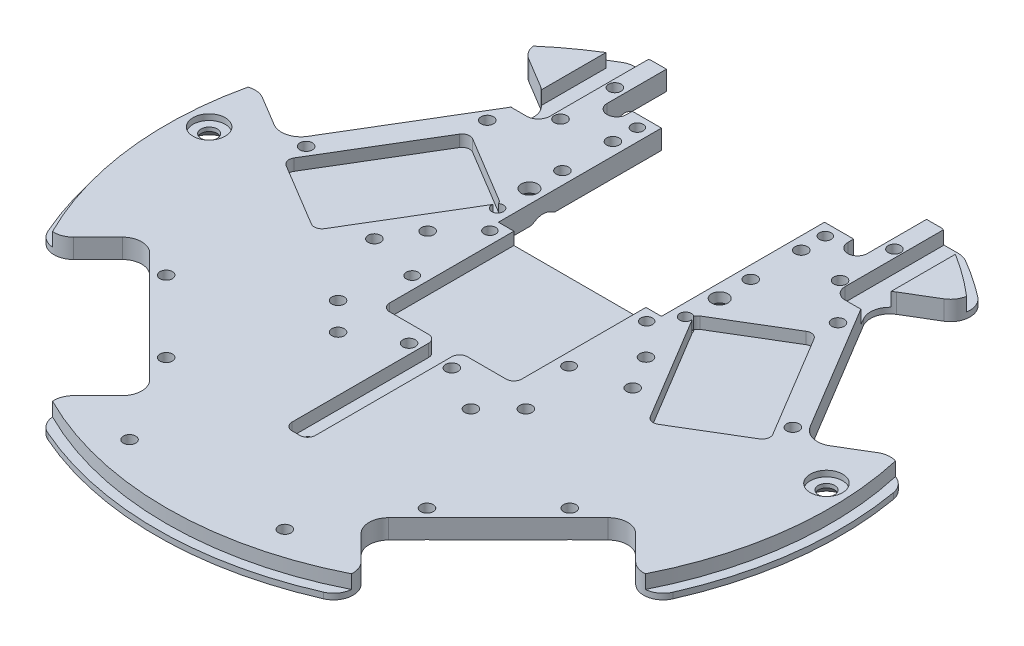
from build123d import *

# Parameters (mm, degrees)
EXTRUDE1_DEPTH      = 5
SKETCH3_W           = 42
SKETCH3_H           = 55.778903352
EXTRUDE2_DEPTH      = 5
EXTRUDE3_DEPTH      = 3.2
EXTRUDE4_DEPTH      = 3
SKETCH6_R           = 1.6
EXTRUDE5_DEPTH      = 5
EXTRUDE6_REACH      = 126.551
SKETCH7_R           = 1.5
EXTRUDE7_DEPTH      = 5
SKETCH9_R           = 1.6
EXTRUDE8_DEPTH      = 5
FILLET2_R           = 2
FILLET3_R           = 5
FILLET4_R           = 5
SKETCH11_R          = 2.1
EXTRUDE10_DEPTH     = 5
SKETCH27_R          = 1.5
SKETCH27_R_2        = 1.531095219
EXTRUDE26_DEPTH     = 5
SKETCH29_R          = 4.15
EXTRUDE28_DEPTH     = 1.5
SKETCH30_R          = 2.1
EXTRUDE29_DEPTH     = 3.5
SKETCH14_R          = 1.6
EXTRUDE30_DEPTH     = 5
CUT_EXTRUDE1_DEPTH  = 3.5
SKETCH33_W          = 7
SKETCH33_H          = 28.5
CUT_EXTRUDE3_DEPTH  = 3.5
FILLET5_R           = 3
SKETCH34_W          = 5
SKETCH34_H          = 4
CUT_EXTRUDE4_DEPTH  = 10
FILLET6_R           = 2.5
SKETCH37_R          = 1.6
CUT_EXTRUDE7_DEPTH  = 10
SKETCH38_R          = 1.25
CUT_EXTRUDE8_DEPTH  = 10
SKETCH39_R          = 1.6
CUT_EXTRUDE9_DEPTH  = 10
SKETCH44_R          = 1.6
CUT_EXTRUDE10_DEPTH = 60
CHAMFER1_SIZE       = 1.5
CHAMFER2_SIZE       = 2.5


# Some blends are built 0.0001 mm under size
with BuildPart() as part:
    # Sketch2 → Extrude1 (new body)
    with BuildSketch(Plane(origin=(0, 0, 0), x_dir=(1, 0, 0), z_dir=(0, 1, 0))):
        with BuildLine():
            Line((85.19872856, 22.026725852), (67.306075467, 11.275735239))
            Line((67.306075467, 11.275735239), (41.554171722, 54.134100274))
            Line((41.554171722, 54.134100274), (59.446824814, 64.885090888))
            ThreePointArc((59.446824814, 64.885090888), (51.56746719, 71.307757836), (43, 76.778903352))
            Line((43, 76.778903352), (-43, 76.778903352))
            ThreePointArc((-43, 76.778903352), (-51.56746719, 71.307757836), (-59.446824814, 64.885090888))
            Line((-59.446824814, 64.885090888), (-41.554171722, 54.134100274))
            Line((-41.554171722, 54.134100274), (-67.306075467, 11.275735239))
            Line((-67.306075467, 11.275735239), (-85.19872856, 22.026725852))
            ThreePointArc((-85.19872856, 22.026725852), (-87.344061344, -10.72450222), (-77.339214934, -41.983875874))
            Line((-77.339214934, -41.983875874), (-62.578950135, -27.223611076))
            Line((-62.578950135, -27.223611076), (-27.223611076, -62.578950135))
            Line((-27.223611076, -62.578950135), (-41.983875874, -77.339214934))
            ThreePointArc((-41.983875874, -77.339214934), (0, -88), (41.983875874, -77.339214934))
            Line((41.983875874, -77.339214934), (27.223611076, -62.578950135))
            Line((27.223611076, -62.578950135), (62.578950135, -27.223611076))
            Line((62.578950135, -27.223611076), (77.339214934, -41.983875874))
            ThreePointArc((77.339214934, -41.983875874), (87.344061344, -10.72450222), (85.19872856, 22.026725852))
        make_face()
    extrude(amount=-EXTRUDE1_DEPTH)

    # Sketch3 → Extrude2 (cut)
    with BuildSketch(Plane(origin=(0, 0, 0), x_dir=(1, 0, 0), z_dir=(0, 1, 0))):
        with Locations((0, 48.889451676)):
            Rectangle(SKETCH3_W, SKETCH3_H)
    extrude(amount=-EXTRUDE2_DEPTH, mode=Mode.SUBTRACT)

    # Sketch4 → Extrude3 (cut)
    with BuildSketch(Plane(origin=(0, 0, 0), x_dir=(-1, 0, 0), z_dir=(0, 1, 0))):
        Polygon((17, 13), (17, -27), (-17, -27), (-17, 13), (-3, 13), (-3, 52.119044648), (3, 52.119044648), (3, 13), align=None)
    extrude(amount=-EXTRUDE3_DEPTH, mode=Mode.SUBTRACT)

    # Sketch5 → Extrude4 (cut)
    with BuildSketch(Plane(origin=(0, 0, 0), x_dir=(1, 0, 0), z_dir=(0, 1, 0))):
        Polygon((42.963261822, -4.517536234), (62.678109738, 7.328339489), (44.651777116, 37.329195014), (24.9369292, 25.483319291), align=None)
    extrude4 = extrude(amount=-EXTRUDE4_DEPTH, mode=Mode.SUBTRACT)

    # Mirror1: Extrude4 across plane
    add(extrude4.mirror(Plane(origin=(0, 0, 0), x_dir=(0, 0, 1), z_dir=(1, 0, 0))), mode=Mode.SUBTRACT)

    # Sketch6 → Extrude5 (cut)
    with BuildSketch(Plane(origin=(0, 0, 0), x_dir=(1, 0, 0), z_dir=(0, 1, 0))):
        with Locations(Location((45.163126719, 42.302978441, 0), (0, 0, 270))):
            Circle(SKETCH6_R)
        with Locations(Location((62.674421266, 13.159290217, 0), (0, 0, 270))):
            Circle(SKETCH6_R)
        with Locations(Location((51.972348417, -33.587572106, 0), (0, 0, 270))):
            Circle(SKETCH6_R)
        with Locations(Location((33.587572106, -51.972348417, 0), (0, 0, 270))):
            Circle(SKETCH6_R)
    extrude5 = extrude(amount=-EXTRUDE5_DEPTH, mode=Mode.SUBTRACT)

    # Mirror2: Extrude5 across plane
    add(extrude5.mirror(Plane(origin=(0, 0, 0), x_dir=(0, 0, 1), z_dir=(1, 0, 0))), mode=Mode.SUBTRACT)

    # Extrude6: up to this face of the body (flat: up to its plane)
    extrude6_end = Plane(part.part.faces().sort_by_distance((0, -5, 8.032320255))[0])
    # Sketch7 → Extrude6 (cut, up to the picked face)
    with BuildSketch(Plane(origin=(0, 0, 0), x_dir=(-1, 0, 0), z_dir=(0, 1, 0)), mode=Mode.PRIVATE) as extrude6_sk1:
        with Locations(Location((-24.2, -60, 0), (0, 0, 90))):
            Circle(SKETCH7_R)
    extrude6_tool1 = split(extrude(extrude6_sk1.sketch, amount=-EXTRUDE6_REACH, mode=Mode.PRIVATE), bisect_by=extrude6_end, keep=Keep.BOTH, mode=Mode.PRIVATE)
    # Sketch7 → Extrude6 (cut, up to the picked face)
    with BuildSketch(Plane(origin=(0, 0, 0), x_dir=(-1, 0, 0), z_dir=(0, 1, 0)), mode=Mode.PRIVATE) as extrude6_sk2:
        with Locations(Location((-24.2, -24, 0), (0, 0, 189.501164513))):
            Circle(SKETCH7_R)
    extrude6_tool2 = split(extrude(extrude6_sk2.sketch, amount=-EXTRUDE6_REACH, mode=Mode.PRIVATE), bisect_by=extrude6_end, keep=Keep.BOTH, mode=Mode.PRIVATE)
    extrude6_1 = extrude6_tool1.solids().sort_by(Axis((24.2, 0, -60), (0, -1, 0)))[0]
    add(extrude6_1, mode=Mode.SUBTRACT)
    extrude6_2 = extrude6_tool2.solids().sort_by(Axis((24.2, 0, -24), (0, -1, 0)))[0]
    add(extrude6_2, mode=Mode.SUBTRACT)
    extrude6 = extrude6_1 + extrude6_2  # Extrude6 as one shape, for the pattern or mirror that repeats it

    # Mirror3: Extrude6 across plane
    add(extrude6.mirror(Plane(origin=(0, 0, 0), x_dir=(0, 0, 1), z_dir=(1, 0, 0))), mode=Mode.SUBTRACT)

    # Sketch8 → Extrude7 (cut)
    with BuildSketch(Plane(origin=(0, 0, 0), x_dir=(1, 0, 0), z_dir=(0, 1, 0))):
        Polygon((33.5, 68.73438437), (33.5, 63), (21, 63), (21, 76.778903352), (33.5, 76.778903352), align=None)
    extrude7 = extrude(amount=-EXTRUDE7_DEPTH, mode=Mode.SUBTRACT)

    # Mirror4: Extrude7 across plane
    add(extrude7.mirror(Plane(origin=(0, 0, 0), x_dir=(0, 0, 1), z_dir=(1, 0, 0))), mode=Mode.SUBTRACT)

    # Sketch9 → Extrude8 (cut)
    with BuildSketch(Plane(origin=(0, 0, 0), x_dir=(1, 0, 0), z_dir=(0, 1, 0))):
        with Locations(Location((36, 66, 0), (0, 0, 270))):
            Circle(SKETCH9_R)
        with Locations(Location((36, 52, 0), (0, 0, 270))):
            Circle(SKETCH9_R)
    extrude8 = extrude(amount=-EXTRUDE8_DEPTH, mode=Mode.SUBTRACT)

    # Mirror5: Extrude8 across plane
    add(extrude8.mirror(Plane(origin=(0, 0, 0), x_dir=(0, 0, 1), z_dir=(1, 0, 0))), mode=Mode.SUBTRACT)

    # Fillet2
    # the kernel refuses this fillet: 2 mm, written as the material it adds along each edge
    with BuildSketch(Plane(origin=(42.963261822, 0, 4.517536234), x_dir=(0.8571673007021109, 0, -0.5150380749100568), z_dir=(0, -1, 0)), Plane(origin=(-42.963261822, 0, 4.517536234), x_dir=(0.5150380749100563, 0, -0.857167300702111), z_dir=(0, -1, 0)), Plane(origin=(-62.678109738, 0, -7.328339489), x_dir=(0.85716730070211, 0, 0.5150380749100579), z_dir=(0, -1, 0))) as fillet2_piece_1:
        with BuildLine():
            CenterArc((FILLET2_R, -FILLET2_R), FILLET2_R, 90, 90)
            Line((0, -FILLET2_R), (0, 0))
            Line((0, 0), (FILLET2_R, 0))
        make_face()
    extrude(amount=3)
    with BuildSketch(Plane(origin=(24.9369292, 0, -25.483319291), x_dir=(0.8571673007021124, 0, -0.5150380749100538), z_dir=(0, -1, 0))) as fillet2_piece_2:
        with BuildLine():
            CenterArc((1.118768015, 2), FILLET2_R, 235.986791547, 34.013208453)
            Line((0, 0.342182722), (0, 0))
            Line((0, 0), (1.118768015, 0))
        make_face()
    extrude(amount=3)
    with BuildSketch(Plane(origin=(44.651777116, 0, -37.329195014), x_dir=(0.5150380749100567, 0, 0.8571673007021108), z_dir=(0, -1, 0)), Plane(origin=(62.678109738, 0, -7.328339489), x_dir=(-0.85716730070211, 0, 0.5150380749100579), z_dir=(0, -1, 0)), Plane(origin=(-44.651777116, 0, -37.329195014), x_dir=(0.8571673007021102, 0, 0.5150380749100578), z_dir=(0, -1, 0))) as fillet2_piece_3:
        with BuildLine():
            CenterArc((FILLET2_R, FILLET2_R), FILLET2_R, 180, 90)
            Line((0, FILLET2_R), (0, 0))
            Line((0, 0), (FILLET2_R, 0))
        make_face()
    extrude(amount=3)
    with BuildSketch(Plane(origin=(-24.9369292, 0, -25.483319291), x_dir=(-0.5150380749118738, 0, 0.857167300701019), z_dir=(0, -1, 0))) as fillet2_piece_4:
        with BuildLine():
            CenterArc((2, 1.118768015), FILLET2_R, 180, 34.013208453)
            Line((0, 1.118768015), (0, 0))
            Line((0, 0), (0.342182722, 0))
        make_face()
    extrude(amount=3)
    with BuildSketch(Plane(origin=(-17, 0, 13), x_dir=(0, 0, -1), z_dir=(0, -1, 0))) as fillet2_piece_5:
        with BuildLine():
            CenterArc((FILLET2_R, FILLET2_R), FILLET2_R, 180, 90)
            Line((0, FILLET2_R), (0, 0))
            Line((0, 0), (FILLET2_R, 0))
        make_face()
    extrude(amount=3.2)
    with BuildSketch(Plane(origin=(17, 0, 13), x_dir=(0, 0, -1), z_dir=(0, -1, 0)), Plane(origin=(3, 0, 52.119044648), x_dir=(0, 0, -1), z_dir=(0, -1, 0)), Plane(origin=(-3, 0, 52.119044648), x_dir=(1, 0, 0), z_dir=(0, -1, 0))) as fillet2_piece_6:
        with BuildLine():
            CenterArc((FILLET2_R, -FILLET2_R), FILLET2_R, 90, 90)
            Line((0, -FILLET2_R), (0, 0))
            Line((0, 0), (FILLET2_R, 0))
        make_face()
    extrude(amount=3.2)
    # the kernel refuses this fillet: 2 mm, written as the material it takes off along each edge
    with BuildSketch(Plane(origin=(3, 5, 13), x_dir=(1, 0, 0), z_dir=(0, -1, 0))) as fillet2_2_piece_1:
        with BuildLine():
            CenterArc((FILLET2_R, FILLET2_R), FILLET2_R, 180, 90)
            Line((0, FILLET2_R), (0, 0))
            Line((0, 0), (FILLET2_R, 0))
        make_face()
    extrude(amount=8.2, mode=Mode.SUBTRACT)
    with BuildSketch(Plane(origin=(-3, 5, 13), x_dir=(-1, 0, 0), z_dir=(0, -1, 0))) as fillet2_2_piece_2:
        with BuildLine():
            CenterArc((FILLET2_R, -FILLET2_R), FILLET2_R, 90, 90)
            Line((0, -FILLET2_R), (0, 0))
            Line((0, 0), (FILLET2_R, 0))
        make_face()
    extrude(amount=8.2, mode=Mode.SUBTRACT)

    # Fillet3
    fillet3_edges = [part.edges().sort_by_distance(p)[0] for p in [
        (77.339214934, -2.5, 41.983875874),
        (62.578950135, -2.5, 27.223611076),
        (27.223611076, -2.5, 62.578950135),
        (41.983875874, -2.5, 77.339214934),
        (-41.983875874, -2.5, 77.339214934),
        (-27.223611076, -2.5, 62.578950135),
        (-62.578950135, -2.5, 27.223611076),
        (-77.339214934, -2.5, 41.983875874),
        (-85.19872856, -2.5, -22.026725852),
        (-67.306075467, -2.5, -11.275735239),
        (-41.554171722, -2.5, -54.134100274),
        (-59.446824814, -2.5, -64.885090888),
        (59.446824814, -2.5, -64.885090888),
        (41.554171722, -2.5, -54.134100274),
        (67.306075467, -2.5, -11.275735239),
        (85.19872856, -2.5, -22.026725852),
    ]]
    fillet(fillet3_edges, radius=FILLET3_R)

    # Fillet4
    fillet4_edges = [part.edges().sort_by_distance(p)[0] for p in [
        (-43, -2.5, -76.778903352),
        (43, -2.5, -76.778903352),
    ]]
    fillet(fillet4_edges, radius=FILLET4_R)

    # Sketch11 → Extrude10 (cut)
    with BuildSketch(Plane(origin=(0, 0, 0), x_dir=(1, 0, 0), z_dir=(0, 1, 0))):
        with Locations(Location((24.5, 32.5, 0), (0, 0, 270))):
            Circle(SKETCH11_R)
        with Locations(Location((-24.5, 32.5, 0), (0, 0, 270))):
            Circle(SKETCH11_R)
    extrude(amount=-EXTRUDE10_DEPTH, mode=Mode.SUBTRACT)

    # Sketch27 → Extrude26 (cut)
    with BuildSketch(Plane(origin=(0, 0, 0), x_dir=(1, 0, 0), z_dir=(0, 1, 0))):
        with Locations(Location((20.2, 18, 0), (0, 0, 270))):
            Circle(SKETCH27_R)
        with Locations(Location((-20.2, 18, 0), (0, 0, 270))):
            Circle(SKETCH27_R)
        with Locations(Location((-20.2, -2, 0), (0, 0, 270))):
            Circle(SKETCH27_R_2)
        with Locations(Location((20.2, -2, 0), (0, 0, 90))):
            Circle(SKETCH27_R_2)
    extrude(amount=-EXTRUDE26_DEPTH, mode=Mode.SUBTRACT)

    # Sketch29 → Extrude28 (cut)
    with BuildSketch(Plane(origin=(0, 0, 0), x_dir=(1, 0, 0), z_dir=(0, 1, 0))):
        with Locations(Location((-79.5, 5, 0), (0, 0, 270))):
            Circle(SKETCH29_R)
        with Locations(Location((79.5, 5, 0), (0, 0, 270))):
            Circle(SKETCH29_R)
    extrude(amount=-EXTRUDE28_DEPTH, mode=Mode.SUBTRACT)

    # Sketch30 → Extrude29 (cut)
    with BuildSketch(Plane(origin=(0, -1.5, 0), x_dir=(1, 0, 0), z_dir=(0, 1, 0))):
        with Locations(Location((79.5, 5, 0), (0, 0, 270))):
            Circle(SKETCH30_R)
        with Locations(Location((-79.5, 5, 0), (0, 0, 270))):
            Circle(SKETCH30_R)
    extrude(amount=-EXTRUDE29_DEPTH, mode=Mode.SUBTRACT)

    # Sketch14 → Extrude30 (cut)
    with BuildSketch(Plane(origin=(0, 0, 0), x_dir=(1, 0, 0), z_dir=(0, 1, 0))):
        with Locations(Location((24.183051917, -17.111984105, 0), (0, 0, 270))):
            Circle(SKETCH14_R)
        with Locations(Location((17.111984105, -24.183051917, 0), (0, 0, 270))):
            Circle(SKETCH14_R)
        with Locations(Location((28.11951363, 9.896107983, 0), (0, 0, 270))):
            Circle(SKETCH14_R)
        with Locations(Location((33.269894379, 1.324434976, 0), (0, 0, 270))):
            Circle(SKETCH14_R)
    extrude30 = extrude(amount=-EXTRUDE30_DEPTH, mode=Mode.SUBTRACT)

    # Mirror9: Extrude30 across plane
    add(extrude30.mirror(Plane(origin=(0, 0, 0), x_dir=(0, 0, 1), z_dir=(1, 0, 0))), mode=Mode.SUBTRACT)

    # Sketch31 → Cut-Extrude1 (cut)
    with BuildSketch(Plane(origin=(0, 0, 0), x_dir=(1, 0, 0), z_dir=(0, 1, 0))):
        with BuildLine():
            Line((-29.58455324, 80.218477981), (-30.449598656, 82.564047513))
            ThreePointArc((-30.449598656, 82.564047513), (1.248527649, -87.991142615), (28.094769088, 83.394747736))
            Line((28.094769088, 83.394747736), (28.261361905, 80.694147392))
            ThreePointArc((28.261361905, 80.694147392), (0.703046353, -85.497109459), (-29.58455324, 80.218477981))
        make_face()
    extrude(amount=-CUT_EXTRUDE1_DEPTH, mode=Mode.SUBTRACT)

    # Sketch33 → Cut-Extrude3 (cut)
    with BuildSketch(Plane(origin=(0, 0, 0), x_dir=(1, 0, 0), z_dir=(0, 1, 0))):
        with Locations((-41.5, 62.528903352)):
            Rectangle(SKETCH33_W, SKETCH33_H)
        with Locations((41.5, 62.528903352)):
            Rectangle(SKETCH33_W, SKETCH33_H)
    extrude(amount=-CUT_EXTRUDE3_DEPTH, mode=Mode.SUBTRACT)

    # Fillet5
    fillet5_edges = [part.edges().sort_by_distance(p)[0] for p in [
        (-38, -1.75, -48.278903352),
        (38, -1.75, -48.278903352),
    ]]
    fillet(fillet5_edges, radius=FILLET5_R)

    # Sketch34 → Cut-Extrude4 (cut)
    with BuildSketch(Plane(origin=(0, 0, 0), x_dir=(1, 0, 0), z_dir=(0, 1, 0))):
        with Locations((-31, 61)):
            Rectangle(SKETCH34_W, SKETCH34_H)
        with Locations((31, 61)):
            Rectangle(SKETCH34_W, SKETCH34_H)
    extrude(amount=-CUT_EXTRUDE4_DEPTH, mode=Mode.SUBTRACT)

    # Fillet6
    fillet6_edges = [part.edges().sort_by_distance(p)[0] for p in [
        (28.5, -2.5, -59),
        (33.5, -2.5, -59),
        (-28.5, -2.5, -59),
        (-33.5, -2.5, -59),
    ]]
    fillet(fillet6_edges, radius=FILLET6_R - 0.0001)  # a hair under: the kernel refuses the full size

    # Sketch37 → Cut-Extrude7 (cut)
    with BuildSketch(Plane(origin=(0, 0, 0), x_dir=(1, 0, 0), z_dir=(0, 1, 0))):
        with Locations(Location((-5.5, -17.5, 0), (0, 0, 270))):
            Circle(SKETCH37_R)
        with Locations(Location((5.5, -17.5, 0), (0, 0, 270))):
            Circle(SKETCH37_R)
    extrude(amount=-CUT_EXTRUDE7_DEPTH, mode=Mode.SUBTRACT)

    # Sketch38 → Cut-Extrude8 (cut)
    with BuildSketch(Plane(origin=(0, -3.2, 0), x_dir=(1, 0, 0), z_dir=(0, 1, 0))):
        with Locations(Location((0, -49, 0), (0, 0, 270))):
            Circle(SKETCH38_R)
    extrude(amount=-CUT_EXTRUDE8_DEPTH, mode=Mode.SUBTRACT)

    # Sketch39 → Cut-Extrude9 (cut)
    with BuildSketch(Plane(origin=(0, 0, 0), x_dir=(1, 0, 0), z_dir=(0, 1, 0))):
        with Locations(Location((-24.25, 53.75, 0), (0, 0, 270))):
            Circle(SKETCH39_R)
        with Locations(Location((-24.25, 40.75, 0), (0, 0, 270))):
            Circle(SKETCH39_R)
        with Locations(Location((24.25, 40.75, 0), (0, 0, 90))):
            Circle(SKETCH39_R)
        with Locations(Location((24.25, 53.75, 0), (0, 0, 90))):
            Circle(SKETCH39_R)
    extrude(amount=-CUT_EXTRUDE9_DEPTH, mode=Mode.SUBTRACT)

    # Sketch44 → Cut-Extrude10 (cut)
    with BuildSketch(Plane(origin=(0, 0, 0), x_dir=(1, 0, 0), z_dir=(0, 1, 0))):
        with Locations(Location((-20, -75, 0), (0, 0, 270))):
            Circle(SKETCH44_R)
        with Locations(Location((20, -75, 0), (0, 0, 90))):
            Circle(SKETCH44_R)
    extrude(amount=-CUT_EXTRUDE10_DEPTH, mode=Mode.SUBTRACT)

    # Chamfer1
    # the kernel refuses this chamfer: 1.5 mm, written as the material it takes off along each edge
    with BuildSketch(Plane(origin=(45.163126719, -5, -42.302978441), x_dir=(0, 0, 1), z_dir=(-1, 0, 0))) as chamfer1_piece_1:
        Polygon((1.6 + CHAMFER1_SIZE, 0), (1.6, CHAMFER1_SIZE), (1.6, 0), align=None)
    revolve(axis=Axis((45.163126719, -5, -42.302978441), (0, 1, 0)), mode=Mode.SUBTRACT)
    with BuildSketch(Plane(origin=(62.674421266, -5, -13.159290217), x_dir=(0, 0, 1), z_dir=(-1, 0, 0))) as chamfer1_piece_2:
        Polygon((1.6 + CHAMFER1_SIZE, 0), (1.6, CHAMFER1_SIZE), (1.6, 0), align=None)
    revolve(axis=Axis((62.674421266, -5, -13.159290217), (0, 1, 0)), mode=Mode.SUBTRACT)
    with BuildSketch(Plane(origin=(51.972348417, -5, 33.587572106), x_dir=(0, 0, 1), z_dir=(-1, 0, 0))) as chamfer1_piece_3:
        Polygon((1.6 + CHAMFER1_SIZE, 0), (1.6, CHAMFER1_SIZE), (1.6, 0), align=None)
    revolve(axis=Axis((51.972348417, -5, 33.587572106), (0, 1, 0)), mode=Mode.SUBTRACT)
    with BuildSketch(Plane(origin=(33.587572106, -5, 51.972348417), x_dir=(0, 0, 1), z_dir=(-1, 0, 0))) as chamfer1_piece_4:
        Polygon((1.6 + CHAMFER1_SIZE, 0), (1.6, CHAMFER1_SIZE), (1.6, 0), align=None)
    revolve(axis=Axis((33.587572106, -5, 51.972348417), (0, 1, 0)), mode=Mode.SUBTRACT)
    with BuildSketch(Plane(origin=(-45.163126719, -5, -42.302978441), x_dir=(0, 0, 1), z_dir=(1, 0, 0))) as chamfer1_piece_5:
        Polygon((1.6 + CHAMFER1_SIZE, 0), (1.6, -CHAMFER1_SIZE), (1.6, 0), align=None)
    revolve(axis=Axis((-45.163126719, -5, -42.302978441), (0, -1, 0)), mode=Mode.SUBTRACT)
    with BuildSketch(Plane(origin=(-62.674421266, -5, -13.159290217), x_dir=(0, 0, 1), z_dir=(1, 0, 0))) as chamfer1_piece_6:
        Polygon((1.6 + CHAMFER1_SIZE, 0), (1.6, -CHAMFER1_SIZE), (1.6, 0), align=None)
    revolve(axis=Axis((-62.674421266, -5, -13.159290217), (0, -1, 0)), mode=Mode.SUBTRACT)
    with BuildSketch(Plane(origin=(-51.972348417, -5, 33.587572106), x_dir=(0, 0, 1), z_dir=(1, 0, 0))) as chamfer1_piece_7:
        Polygon((1.6 + CHAMFER1_SIZE, 0), (1.6, -CHAMFER1_SIZE), (1.6, 0), align=None)
    revolve(axis=Axis((-51.972348417, -5, 33.587572106), (0, -1, 0)), mode=Mode.SUBTRACT)
    with BuildSketch(Plane(origin=(-33.587572106, -5, 51.972348417), x_dir=(0, 0, 1), z_dir=(1, 0, 0))) as chamfer1_piece_8:
        Polygon((1.6 + CHAMFER1_SIZE, 0), (1.6, -CHAMFER1_SIZE), (1.6, 0), align=None)
    revolve(axis=Axis((-33.587572106, -5, 51.972348417), (0, -1, 0)), mode=Mode.SUBTRACT)
    with BuildSketch(Plane(origin=(24.2, -5, -60), x_dir=(0, 0, 1), z_dir=(-1, 0, 0))) as chamfer1_piece_9:
        Polygon((1.5 + CHAMFER1_SIZE, 0), (1.5, CHAMFER1_SIZE), (1.5, 0), align=None)
    revolve(axis=Axis((24.2, -5, -60), (0, 1, 0)), mode=Mode.SUBTRACT)
    with BuildSketch(Plane(origin=(24.2, -5, -24), x_dir=(0.986282246809255, 0, -0.16506765167314788), z_dir=(0.16506765167314788, 0, 0.986282246809255))) as chamfer1_piece_10:
        Polygon((1.5 + CHAMFER1_SIZE, 0), (1.5, CHAMFER1_SIZE), (1.5, 0), align=None)
    revolve(axis=Axis((24.2, -5, -24), (0, 1, 0)), mode=Mode.SUBTRACT)
    with BuildSketch(Plane(origin=(-24.2, -5, -60), x_dir=(0, 0, 1), z_dir=(1, 0, 0))) as chamfer1_piece_11:
        Polygon((1.5 + CHAMFER1_SIZE, 0), (1.5, -CHAMFER1_SIZE), (1.5, 0), align=None)
    revolve(axis=Axis((-24.2, -5, -60), (0, -1, 0)), mode=Mode.SUBTRACT)
    with BuildSketch(Plane(origin=(-24.2, -5, -24), x_dir=(-0.986282246809255, 0, -0.16506765167314788), z_dir=(-0.16506765167314788, 0, 0.986282246809255))) as chamfer1_piece_12:
        Polygon((1.5 + CHAMFER1_SIZE, 0), (1.5, -CHAMFER1_SIZE), (1.5, 0), align=None)
    revolve(axis=Axis((-24.2, -5, -24), (0, -1, 0)), mode=Mode.SUBTRACT)
    with BuildSketch(Plane(origin=(36, -5, -66), x_dir=(0, 0, 1), z_dir=(-1, 0, 0))) as chamfer1_piece_13:
        Polygon((1.6 + CHAMFER1_SIZE, 0), (1.6, CHAMFER1_SIZE), (1.6, 0), align=None)
    revolve(axis=Axis((36, -5, -66), (0, 1, 0)), mode=Mode.SUBTRACT)
    with BuildSketch(Plane(origin=(36, -5, -52), x_dir=(0, 0, 1), z_dir=(-1, 0, 0))) as chamfer1_piece_14:
        Polygon((1.6 + CHAMFER1_SIZE, 0), (1.6, CHAMFER1_SIZE), (1.6, 0), align=None)
    revolve(axis=Axis((36, -5, -52), (0, 1, 0)), mode=Mode.SUBTRACT)
    with BuildSketch(Plane(origin=(-36, -5, -66), x_dir=(0, 0, 1), z_dir=(1, 0, 0))) as chamfer1_piece_15:
        Polygon((1.6 + CHAMFER1_SIZE, 0), (1.6, -CHAMFER1_SIZE), (1.6, 0), align=None)
    revolve(axis=Axis((-36, -5, -66), (0, -1, 0)), mode=Mode.SUBTRACT)
    with BuildSketch(Plane(origin=(-36, -5, -52), x_dir=(0, 0, 1), z_dir=(1, 0, 0))) as chamfer1_piece_16:
        Polygon((1.6 + CHAMFER1_SIZE, 0), (1.6, -CHAMFER1_SIZE), (1.6, 0), align=None)
    revolve(axis=Axis((-36, -5, -52), (0, -1, 0)), mode=Mode.SUBTRACT)
    with BuildSketch(Plane(origin=(20.2, -5, -18), x_dir=(0, 0, 1), z_dir=(-1, 0, 0))) as chamfer1_piece_17:
        Polygon((1.5 + CHAMFER1_SIZE, 0), (1.5, CHAMFER1_SIZE), (1.5, 0), align=None)
    revolve(axis=Axis((20.2, -5, -18), (0, 1, 0)), mode=Mode.SUBTRACT)
    with BuildSketch(Plane(origin=(-20.2, -5, -18), x_dir=(0, 0, 1), z_dir=(-1, 0, 0))) as chamfer1_piece_18:
        Polygon((1.5 + CHAMFER1_SIZE, 0), (1.5, CHAMFER1_SIZE), (1.5, 0), align=None)
    revolve(axis=Axis((-20.2, -5, -18), (0, 1, 0)), mode=Mode.SUBTRACT)
    with BuildSketch(Plane(origin=(-20.2, -5, 2), x_dir=(0, 0, 1), z_dir=(-1, 0, 0))) as chamfer1_piece_19:
        Polygon((1.531095219 + CHAMFER1_SIZE, 0), (1.531095219, CHAMFER1_SIZE), (1.531095219, 0), align=None)
    revolve(axis=Axis((-20.2, -5, 2), (0, 1, 0)), mode=Mode.SUBTRACT)
    with BuildSketch(Plane(origin=(20.2, -5, 2), x_dir=(0, 0, -1), z_dir=(1, 0, 0))) as chamfer1_piece_20:
        Polygon((1.531095219 + CHAMFER1_SIZE, 0), (1.531095219, CHAMFER1_SIZE), (1.531095219, 0), align=None)
    revolve(axis=Axis((20.2, -5, 2), (0, 1, 0)), mode=Mode.SUBTRACT)
    with BuildSketch(Plane(origin=(24.183051917, -5, 17.111984105), x_dir=(0, 0, 1), z_dir=(-1, 0, 0))) as chamfer1_piece_21:
        Polygon((1.6 + CHAMFER1_SIZE, 0), (1.6, CHAMFER1_SIZE), (1.6, 0), align=None)
    revolve(axis=Axis((24.183051917, -5, 17.111984105), (0, 1, 0)), mode=Mode.SUBTRACT)
    with BuildSketch(Plane(origin=(17.111984105, -5, 24.183051917), x_dir=(0, 0, 1), z_dir=(-1, 0, 0))) as chamfer1_piece_22:
        Polygon((1.6 + CHAMFER1_SIZE, 0), (1.6, CHAMFER1_SIZE), (1.6, 0), align=None)
    revolve(axis=Axis((17.111984105, -5, 24.183051917), (0, 1, 0)), mode=Mode.SUBTRACT)
    with BuildSketch(Plane(origin=(28.11951363, -5, -9.896107983), x_dir=(0, 0, 1), z_dir=(-1, 0, 0))) as chamfer1_piece_23:
        Polygon((1.6 + CHAMFER1_SIZE, 0), (1.6, CHAMFER1_SIZE), (1.6, 0), align=None)
    revolve(axis=Axis((28.11951363, -5, -9.896107983), (0, 1, 0)), mode=Mode.SUBTRACT)
    with BuildSketch(Plane(origin=(33.269894379, -5, -1.324434976), x_dir=(0, 0, 1), z_dir=(-1, 0, 0))) as chamfer1_piece_24:
        Polygon((1.6 + CHAMFER1_SIZE, 0), (1.6, CHAMFER1_SIZE), (1.6, 0), align=None)
    revolve(axis=Axis((33.269894379, -5, -1.324434976), (0, 1, 0)), mode=Mode.SUBTRACT)
    with BuildSketch(Plane(origin=(-24.183051917, -5, 17.111984105), x_dir=(0, 0, 1), z_dir=(1, 0, 0))) as chamfer1_piece_25:
        Polygon((1.6 + CHAMFER1_SIZE, 0), (1.6, -CHAMFER1_SIZE), (1.6, 0), align=None)
    revolve(axis=Axis((-24.183051917, -5, 17.111984105), (0, -1, 0)), mode=Mode.SUBTRACT)
    with BuildSketch(Plane(origin=(-17.111984105, -5, 24.183051917), x_dir=(0, 0, 1), z_dir=(1, 0, 0))) as chamfer1_piece_26:
        Polygon((1.6 + CHAMFER1_SIZE, 0), (1.6, -CHAMFER1_SIZE), (1.6, 0), align=None)
    revolve(axis=Axis((-17.111984105, -5, 24.183051917), (0, -1, 0)), mode=Mode.SUBTRACT)
    with BuildSketch(Plane(origin=(-28.11951363, -5, -9.896107983), x_dir=(0, 0, 1), z_dir=(1, 0, 0))) as chamfer1_piece_27:
        Polygon((1.6 + CHAMFER1_SIZE, 0), (1.6, -CHAMFER1_SIZE), (1.6, 0), align=None)
    revolve(axis=Axis((-28.11951363, -5, -9.896107983), (0, -1, 0)), mode=Mode.SUBTRACT)
    with BuildSketch(Plane(origin=(-33.269894379, -5, -1.324434976), x_dir=(0, 0, 1), z_dir=(1, 0, 0))) as chamfer1_piece_28:
        Polygon((1.6 + CHAMFER1_SIZE, 0), (1.6, -CHAMFER1_SIZE), (1.6, 0), align=None)
    revolve(axis=Axis((-33.269894379, -5, -1.324434976), (0, -1, 0)), mode=Mode.SUBTRACT)
    with BuildSketch(Plane(origin=(-5.5, -5, 17.5), x_dir=(0, 0, 1), z_dir=(-1, 0, 0))) as chamfer1_piece_29:
        Polygon((1.6 + CHAMFER1_SIZE, 0), (1.6, CHAMFER1_SIZE), (1.6, 0), align=None)
    revolve(axis=Axis((-5.5, -5, 17.5), (0, 1, 0)), mode=Mode.SUBTRACT)
    with BuildSketch(Plane(origin=(5.5, -5, 17.5), x_dir=(0, 0, 1), z_dir=(-1, 0, 0))) as chamfer1_piece_30:
        Polygon((1.6 + CHAMFER1_SIZE, 0), (1.6, CHAMFER1_SIZE), (1.6, 0), align=None)
    revolve(axis=Axis((5.5, -5, 17.5), (0, 1, 0)), mode=Mode.SUBTRACT)
    with BuildSketch(Plane(origin=(24.25, -5, -53.75), x_dir=(0, 0, -1), z_dir=(1, 0, 0))) as chamfer1_piece_31:
        Polygon((1.6 + CHAMFER1_SIZE, 0), (1.6, CHAMFER1_SIZE), (1.6, 0), align=None)
    revolve(axis=Axis((24.25, -5, -53.75), (0, 1, 0)), mode=Mode.SUBTRACT)
    with BuildSketch(Plane(origin=(24.25, -5, -40.75), x_dir=(0, 0, -1), z_dir=(1, 0, 0))) as chamfer1_piece_32:
        Polygon((1.6 + CHAMFER1_SIZE, 0), (1.6, CHAMFER1_SIZE), (1.6, 0), align=None)
    revolve(axis=Axis((24.25, -5, -40.75), (0, 1, 0)), mode=Mode.SUBTRACT)
    with BuildSketch(Plane(origin=(-24.25, -5, -40.75), x_dir=(0, 0, 1), z_dir=(-1, 0, 0))) as chamfer1_piece_33:
        Polygon((1.6 + CHAMFER1_SIZE, 0), (1.6, CHAMFER1_SIZE), (1.6, 0), align=None)
    revolve(axis=Axis((-24.25, -5, -40.75), (0, 1, 0)), mode=Mode.SUBTRACT)
    with BuildSketch(Plane(origin=(-24.25, -5, -53.75), x_dir=(0, 0, 1), z_dir=(-1, 0, 0))) as chamfer1_piece_34:
        Polygon((1.6 + CHAMFER1_SIZE, 0), (1.6, CHAMFER1_SIZE), (1.6, 0), align=None)
    revolve(axis=Axis((-24.25, -5, -53.75), (0, 1, 0)), mode=Mode.SUBTRACT)
    with BuildSketch(Plane(origin=(-20, -5, 75), x_dir=(0, 0, 1), z_dir=(-1, 0, 0))) as chamfer1_piece_35:
        Polygon((1.6 + CHAMFER1_SIZE, 0), (1.6, CHAMFER1_SIZE), (1.6, 0), align=None)
    revolve(axis=Axis((-20, -5, 75), (0, 1, 0)), mode=Mode.SUBTRACT)
    with BuildSketch(Plane(origin=(20, -5, 75), x_dir=(0, 0, -1), z_dir=(1, 0, 0))) as chamfer1_piece_36:
        Polygon((1.6 + CHAMFER1_SIZE, 0), (1.6, CHAMFER1_SIZE), (1.6, 0), align=None)
    revolve(axis=Axis((20, -5, 75), (0, 1, 0)), mode=Mode.SUBTRACT)

    # Chamfer2
    # the kernel refuses this chamfer: 2.5 mm, written as the material it takes off along each edge
    with BuildSketch(Plane(origin=(24.5, -5, -32.5), x_dir=(0, 0, 1), z_dir=(-1, 0, 0))) as chamfer2_piece_1:
        Polygon((2.1 + CHAMFER2_SIZE, 0), (2.1, CHAMFER2_SIZE), (2.1, 0), align=None)
    revolve(axis=Axis((24.5, -5, -32.5), (0, 1, 0)), mode=Mode.SUBTRACT)
    with BuildSketch(Plane(origin=(-24.5, -5, -32.5), x_dir=(0, 0, 1), z_dir=(-1, 0, 0))) as chamfer2_piece_2:
        Polygon((2.1 + CHAMFER2_SIZE, 0), (2.1, CHAMFER2_SIZE), (2.1, 0), align=None)
    revolve(axis=Axis((-24.5, -5, -32.5), (0, 1, 0)), mode=Mode.SUBTRACT)
    with BuildSketch(Plane(origin=(79.5, -5, -5), x_dir=(0, 0, 1), z_dir=(-1, 0, 0))) as chamfer2_piece_3:
        Polygon((2.1 + CHAMFER2_SIZE, 0), (2.1, CHAMFER2_SIZE), (2.1, 0), align=None)
    revolve(axis=Axis((79.5, -5, -5), (0, 1, 0)), mode=Mode.SUBTRACT)
    with BuildSketch(Plane(origin=(-79.5, -5, -5), x_dir=(0, 0, 1), z_dir=(-1, 0, 0))) as chamfer2_piece_4:
        Polygon((2.1 + CHAMFER2_SIZE, 0), (2.1, CHAMFER2_SIZE), (2.1, 0), align=None)
    revolve(axis=Axis((-79.5, -5, -5), (0, 1, 0)), mode=Mode.SUBTRACT)


solid = part.part
